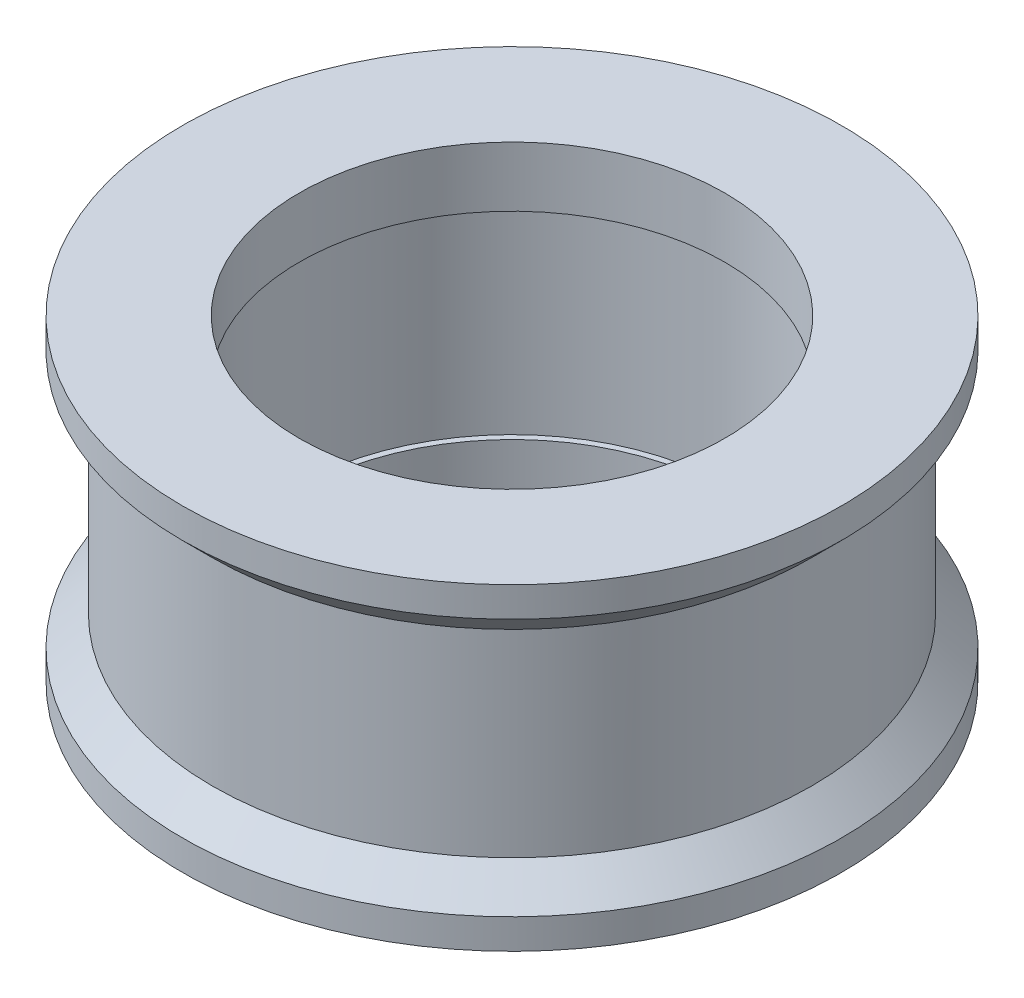
from build123d import *

# Parameters (mm, degrees)
SKETCH_1_R      = 5
SKETCH_1_R_2    = 3.65
EXTRUDE_1_DEPTH = 3.3
SKETCH_2_R      = 5.5
SKETCH_2_R_2    = 3.55
EXTRUDE_2_DEPTH = 1
EXTRUDE_START   = 1
SKETCH_3_R      = 5.5
SKETCH_3_R_2    = 3.55
EXTRUDE_3_DEPTH = 1
CHAMFER_1_SIZE  = 0.5


with BuildPart() as part:
    # 草图1 → 凸台-拉伸1 (new body)
    with BuildSketch(Plane(origin=(0, 0, 0), x_dir=(1, 0, 0), z_dir=(0, 1, 0))):
        with Locations(Location((0, 0, 0), (0, 0, 270))):
            Circle(SKETCH_1_R)
        with Locations(Location((0, 0, 0), (0, 0, 270))):
            Circle(SKETCH_1_R_2, mode=Mode.SUBTRACT)
    extrude(amount=EXTRUDE_1_DEPTH)

    # 草图2 → 凸台-拉伸2 (add)
    with BuildSketch(Plane.XZ):
        with Locations(Location((0, 0, 0), (0, 0, 270))):
            Circle(SKETCH_2_R)
        with Locations(Location((0, 0, 0), (0, 0, 270))):
            Circle(SKETCH_2_R_2, mode=Mode.SUBTRACT)
    extrude(amount=EXTRUDE_2_DEPTH)

    # 草图3 → 凸台-拉伸3 (add)
    with BuildSketch(Plane(origin=(0, 3.3, 0), x_dir=(1, 0, 0), z_dir=(0, 1, 0)).offset(EXTRUDE_START)):
        with Locations(Location((0, 0, 0), (0, 0, 90))):
            Circle(SKETCH_3_R)
        with Locations(Location((0, 0, 0), (0, 0, 90))):
            Circle(SKETCH_3_R_2, mode=Mode.SUBTRACT)
    extrude(amount=-EXTRUDE_3_DEPTH)

    # 倒角1
    chamfer_1_edges = [part.edges().sort_by_distance(p)[0] for p in [
        (0, 0, 5.5),
        (0, 3.3, 5.5),
    ]]
    chamfer(chamfer_1_edges, length=CHAMFER_1_SIZE - 0.0001)  # a hair under: the kernel refuses the full size


solid = part.part
